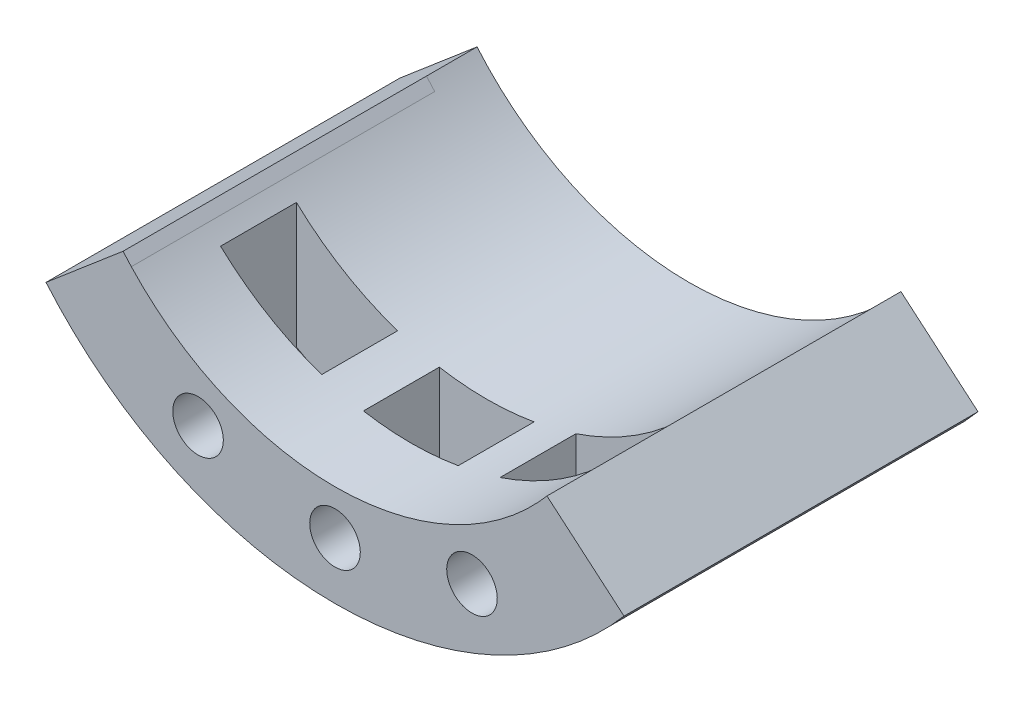
from build123d import *

# Parameters (mm, degrees)
SKETCH_1_R                = 20
SKETCH_1_R_2              = 2
EXTRUDE_1_DEPTH           = 4
EXTRUDE_START             = -4
EXTRUDE_2_DEPTH           = 4
FILLET_2_R                = 5
FILLET_3_R                = 5
SKETCH_3_R                = 58.160089131
SKETCH_3_R_2              = 39.60449563
CUT_EXTRUDE_1_DEPTH       = 4
FILLET_4_R                = 8
EXTRUDE_3_DEPTH           = 4
SKETCH_5_R                = 2
CUT_EXTRUDE_2_DEPTH       = 4
SKETCH_6_R                = 2
CUT_EXTRUDE_3_DEPTH       = 10
EXTRUDE_4_DEPTH           = 4
EXTRUDE_6_DEPTH           = 4
CUT_EXTRUDE_6_DEPTH       = 4
FILLET_6_R                = 10
FILLET_7_R                = 10
FILLET_8_R                = 10
SKETCH_11_R               = 2
EXTRUDE_7_DEPTH           = 4
SKETCH_12_R               = 54.16696545
SKETCH_12_R_2             = 30
CUT_EXTRUDE_7_DEPTH       = 4
FILLET_10_R               = 5
FILLET_11_R               = 5
SKETCH_13_R               = 2
CUT_EXTRUDE_8_DEPTH       = 4
EXTRUDE_START_2           = 28
EXTRUDE_8_DEPTH           = 28
EXTRUDE_START_3           = -28
EXTRUDE_9_DEPTH           = 28
EXTRUDE_10_DEPTH          = 4
CUT_EXTRUDE_START         = -10
SKETCH_17_R               = 2
CUT_EXTRUDE_9_DEPTH       = 10
CUT_EXTRUDE_11_DEPTH      = 35
CUT_EXTRUDE_12_DEPTH      = 36
CUT_EXTRUDE_12_DEPTH_BACK = 36
SKETCH_19_W               = 5.49642493
SKETCH_19_H               = 52.333928513
CUT_EXTRUDE_13_DEPTH      = 40


with BuildPart() as part:
    # 草图1 → 凸台-拉伸1 (new body)
    with BuildSketch(Plane.XY):
        Circle(SKETCH_1_R)
        with Locations((-15, 0)):
            Circle(SKETCH_1_R_2, mode=Mode.SUBTRACT)
        with Locations((15, 0)):
            Circle(SKETCH_1_R_2, mode=Mode.SUBTRACT)
        with Locations((-7.5, 12.990381057)):
            Circle(SKETCH_1_R_2, mode=Mode.SUBTRACT)
        with Locations((-7.5, -12.990381057)):
            Circle(SKETCH_1_R_2, mode=Mode.SUBTRACT)
        with Locations((7.5, -12.990381057)):
            Circle(SKETCH_1_R_2, mode=Mode.SUBTRACT)
        with Locations((7.5, 12.990381057)):
            Circle(SKETCH_1_R_2, mode=Mode.SUBTRACT)
    extrude(amount=EXTRUDE_1_DEPTH)

    # 草图2 → 凸台-拉伸2 (add)
    with BuildSketch(Plane.XY.offset(4).offset(EXTRUDE_START)):
        with BuildLine():
            add(Edge.make_bspline(
                [(-31.652235688, -31.652235688), (-33.388516019, -22.659494294), (-23.392443281, -20.962737075), (-16.1166561, -16.161254448), (-15.240575556, -12.950863166)],
                knots=[0, 0, 0, 0, 0.575012139, 0.86884139, 0.86884139, 0.86884139, 0.86884139], degree=3))
            ThreePointArc((-31.652235688, -31.652235688), (0, -44.76302099), (31.652235688, -31.652235688))
            add(Edge.make_bspline(
                [(31.652235688, -31.652235688), (33.388516019, -22.659494294), (23.392443281, -20.962737075), (16.1166561, -16.161254448), (15.240575556, -12.950863166)],
                knots=[0, 0, 0, 0, 0.575012139, 0.86884139, 0.86884139, 0.86884139, 0.86884139], degree=3))
            ThreePointArc((15.240575556, -12.950863166), (0, -20), (-15.240575556, -12.950863166))
        make_face()
    extrude(amount=EXTRUDE_2_DEPTH)

    # 圆角2
    fillet_2_edges = [part.edges().sort_by_distance(p)[0] for p in [
        (-31.652235688, -31.652235688, 2),
    ]]
    fillet(fillet_2_edges, radius=FILLET_2_R)

    # 圆角3
    fillet_3_edges = [part.edges().sort_by_distance(p)[0] for p in [
        (31.652235688, -31.652235688, 2),
    ]]
    fillet(fillet_3_edges, radius=FILLET_3_R)

    # 草图3 → 切除-拉伸1 (cut)
    with BuildSketch(Plane(origin=(0, 0, 0), x_dir=(-1, 0, 0), z_dir=(0, 0, -1))):
        Circle(SKETCH_3_R)
        Circle(SKETCH_3_R_2, mode=Mode.SUBTRACT)
    extrude(amount=-CUT_EXTRUDE_1_DEPTH, mode=Mode.SUBTRACT)

    # 圆角4
    fillet_4_edges = [part.edges().sort_by_distance(p)[0] for p in [
        (30.87581987, -24.803221997, 2),
        (-30.87581987, -24.803221997, 2),
    ]]
    fillet(fillet_4_edges, radius=FILLET_4_R)

    # 草图4 → 凸台-拉伸3 (add)
    with BuildSketch(Plane(origin=(0, 0, 0), x_dir=(-1, 0, 0), z_dir=(0, 0, -1))):
        with BuildLine():
            Line((-22.183787779, -32.808468935), (-22.405322857, -33.136105801))
            ThreePointArc((-22.405322857, -33.136105801), (0.038199329, -39.99998176), (22.468570811, -33.093251967))
            Line((22.468570811, -33.093251967), (22.183787779, -32.808468935))
            ThreePointArc((22.183787779, -32.808468935), (0, -39.60449563), (-22.183787779, -32.808468935))
        make_face()
    extrude(amount=-EXTRUDE_3_DEPTH)

    # 草图5 → 切除-拉伸2 (cut)
    with BuildSketch(Plane(origin=(0, 0, 0), x_dir=(-1, 0, 0), z_dir=(0, 0, -1))):
        with Locations((-15.848184815, -33.986542014)):
            Circle(SKETCH_5_R)
        with Locations((0, -37.5)):
            Circle(SKETCH_5_R)
        with Locations(Location((15.848184815, -33.986542014, 0), (0, 0, 180))):
            Circle(SKETCH_5_R)
    extrude(amount=-CUT_EXTRUDE_2_DEPTH, mode=Mode.SUBTRACT)

    # 草图6 → 切除-拉伸3 (cut)
    with BuildSketch(Plane(origin=(0, 0, 0), x_dir=(-1, 0, 0), z_dir=(0, 0, -1))):
        with Locations((0.038199329, -29.99998176)):
            Circle(SKETCH_6_R)
    extrude(amount=-CUT_EXTRUDE_3_DEPTH, mode=Mode.SUBTRACT)

    # 草图7 → 凸台-拉伸4 (add)
    with BuildSketch(Plane.XY.offset(4)):
        with BuildLine():
            Line((-22.468570811, -33.093251967), (-23.907156981, -34.531838137))
            ThreePointArc((-23.907156981, -34.531838137), (-0.231167262, -41.999363825), (23.525589, -34.792911091))
            Line((23.525589, -34.792911091), (22.405322857, -33.136105801))
            Line((22.405322857, -33.136105801), (22.183787779, -32.808468935))
            ThreePointArc((22.183787779, -32.808468935), (0, -39.60449563), (-22.183787779, -32.808468935))
            Line((-22.183787779, -32.808468935), (-22.468570811, -33.093251967))
        make_face()
    extrude(amount=-EXTRUDE_4_DEPTH)

    # 草图8 → 凸台-拉伸6 (add)
    with BuildSketch(Plane(origin=(0, 0, 0), x_dir=(-1, 0, 0), z_dir=(0, 0, -1))):
        with BuildLine():
            Line((-25.678439695, -25.558394246), (-20.516854663, -32.863070329))
            Line((-20.516854663, -32.863070329), (-23.525589, -34.792911091))
            add(Edge.make_bspline(
                [(-23.525589, -34.792911091), (-26.001835591, -30.056258517), (-25.678439695, -25.558394246)],
                knots=[0, 0, 0, 0.47951431, 0.47951431, 0.47951431], degree=2))
        make_face()
        with BuildLine():
            Line((20.516854663, -32.863070329), (23.525589, -34.792911091))
            add(Edge.make_bspline(
                [(23.525589, -34.792911091), (26.001835591, -30.056258517), (25.678439695, -25.558394246)],
                knots=[0, 0, 0, 0.47951431, 0.47951431, 0.47951431], degree=2))
            Line((25.678439695, -25.558394246), (20.516854663, -32.863070329))
        make_face()
    extrude(amount=-EXTRUDE_6_DEPTH)

    # 草图9 → 切除-拉伸6 (cut)
    with BuildSketch(Plane(origin=(0, 0, 0), x_dir=(-1, 0, 0), z_dir=(0, 0, -1))):
        Polygon((23.742659966, -34.367341122), (22.906265437, -35.20373565), (24.433492861, -34.374984505), align=None)
    extrude(amount=-CUT_EXTRUDE_6_DEPTH, mode=Mode.SUBTRACT)

    # 圆角6
    fillet_6_edges = [part.edges().sort_by_distance(p)[0] for p in [
        (23.525589, -34.792911091, 2),
    ]]
    fillet(fillet_6_edges, radius=FILLET_6_R)

    # 圆角7
    # the kernel refuses this fillet: 10 mm, written as the material it takes off along each edge
    with BuildSketch(Plane(origin=(-23.742659966, -34.367341122, 10.292446297), x_dir=(0.7071067812003878, -0.7071067811727072, 0), z_dir=(0, 0, -1))) as fillet_7_piece_1:
        with BuildLine():
            CenterArc((1.956172782, -9.970053017), FILLET_7_R, 94.435296014, 20.980736708)
            Line((-2.335706132, -0.937900705), (-2.42154371, -0.757257658))
            ThreePointArc((-2.42154371, -0.757257658), (-1.256201499, -0.248323162), (-0.06365122, 0.189600955))
            Line((-0.06365122, 0.189600955), (0, 0.2))
            ThreePointArc((0, 0.2), (0.591420243, 0.2), (1.16737384, 0.19940106))
            Line((1.16737384, 0.19940106), (1.182840486, 0))
        make_face()
    extrude(amount=16.584892581, mode=Mode.SUBTRACT)

    # 圆角8
    fillet_8_edges = [part.edges().sort_by_distance(p)[0] for p in [
        (-22.906265437, -35.20373565, 2),
    ]]
    fillet(fillet_8_edges, radius=FILLET_8_R)

    # 草图11 → 凸台-拉伸7 (add)
    with BuildSketch(Plane(origin=(0, 0, 0), x_dir=(-1, 0, 0), z_dir=(0, 0, -1))):
        with Locations((0.038199329, -29.99998176)):
            Circle(SKETCH_11_R)
        with Locations((0, -37.5)):
            Circle(SKETCH_11_R)
        with Locations((15.848184815, -33.986542014)):
            Circle(SKETCH_11_R)
        with Locations((-15.848184815, -33.986542014)):
            Circle(SKETCH_11_R)
    extrude(amount=-EXTRUDE_7_DEPTH)

    # 草图12 → 切除-拉伸7 (cut)
    with BuildSketch(Plane(origin=(0, 0, 0), x_dir=(-1, 0, 0), z_dir=(0, 0, -1))):
        Circle(SKETCH_12_R)
        Circle(SKETCH_12_R_2, mode=Mode.SUBTRACT)
    extrude(amount=-CUT_EXTRUDE_7_DEPTH, mode=Mode.SUBTRACT)

    # 圆角10
    fillet_10_edges = [part.edges().sort_by_distance(p)[0] for p in [
        (-22.533836729, -19.804701519, 2),
    ]]
    fillet(fillet_10_edges, radius=FILLET_10_R)

    # 圆角11
    fillet_11_edges = [part.edges().sort_by_distance(p)[0] for p in [
        (22.533836729, -19.804701519, 2),
    ]]
    fillet(fillet_11_edges, radius=FILLET_11_R)

    # 草图13 → 切除-拉伸8 (cut)
    with BuildSketch(Plane(origin=(0, 0, 0), x_dir=(-1, 0, 0), z_dir=(0, 0, -1))):
        with Locations((0, -25.5)):
            Circle(SKETCH_13_R)
        with Locations((-10.834875534, -23.235465565)):
            Circle(SKETCH_13_R)
        with Locations(Location((10.834875534, -23.235465565, 0), (0, 0, 180))):
            Circle(SKETCH_13_R)
    extrude(amount=-CUT_EXTRUDE_8_DEPTH, mode=Mode.SUBTRACT)

    # 草图14 → 凸台-拉伸8 (add)
    with BuildSketch(Plane(origin=(0, 0, 0), x_dir=(-1, 0, 0), z_dir=(0, 0, -1)).offset(EXTRUDE_START_2)):
        with BuildLine():
            Line((-16.764633111, -14.245949482), (-22.860863333, -19.426294749))
            ThreePointArc((-22.860863333, -19.426294749), (0, -30), (22.860863333, -19.426294749))
            Line((22.860863333, -19.426294749), (16.764633111, -14.245949482))
            ThreePointArc((16.764633111, -14.245949482), (0, -22), (-16.764633111, -14.245949482))
        make_face()
    extrude(amount=-EXTRUDE_8_DEPTH)

    # 草图15 → 凸台-拉伸9 (add)
    with BuildSketch(Plane.XY.offset(4).offset(EXTRUDE_START_3)):
        with BuildLine():
            Line((-22.860863333, -19.426294749), (-16.764633111, -14.245949482))
            Line((-16.764633111, -14.245949482), (-16.112026358, -14.980073652))
            Line((-16.112026358, -14.980073652), (-17.163654071, -24.605060027))
            ThreePointArc((-17.163654071, -24.605060027), (-20.17908325, -22.19920267), (-22.860863333, -19.426294749))
        make_face()
        with BuildLine():
            Line((16.112026358, -14.980073652), (17.163654071, -24.605060027))
            ThreePointArc((17.163654071, -24.605060027), (20.17908325, -22.19920267), (22.860863333, -19.426294749))
            Line((22.860863333, -19.426294749), (16.764633111, -14.245949482))
            Line((16.764633111, -14.245949482), (16.112026358, -14.980073652))
        make_face()
    extrude(amount=EXTRUDE_9_DEPTH)

    # 草图16 → 凸台-拉伸10 (add)
    with BuildSketch(Plane.XY.offset(4)):
        Polygon((22.860863333, -19.426294749), (12.832928653, -10.904936129), (17.846895993, -20.488091499), align=None)
        Polygon((-17.846895993, -20.488091499), (-22.860863333, -19.426294749), (-12.832928653, -10.904936129), align=None)
    extrude(amount=-EXTRUDE_10_DEPTH)

    # 草图17 → 切除-拉伸9 (cut)
    with BuildSketch(Plane.XY.offset(4).offset(CUT_EXTRUDE_START)):
        with Locations((-10.834875534, -23.235465565)):
            Circle(SKETCH_17_R)
        with Locations(Location((0, -25.5, 0), (0, 0, 180))):
            Circle(SKETCH_17_R)
        with Locations(Location((10.834875534, -23.235465565, 0), (0, 0, 180))):
            Circle(SKETCH_17_R)
    extrude(amount=CUT_EXTRUDE_9_DEPTH, mode=Mode.SUBTRACT)

    # 草图18 → 切除-拉伸11 (cut)
    with BuildSketch(Plane(origin=(0, 0, 0), x_dir=(1, 0, 0), z_dir=(0, 1, 0))):
        Polygon((13.552574472, 6), (11.552574472, 6), (8.552574472, 6), (8.552574472, 9), (11.552574472, 9), (13.552574472, 9), align=None)
        Polygon((-2, 9), (-2.5, 9), (-2.5, 6), (-2, 6), (0, 6), (2, 6), (2.5, 6), (2.5, 9), (2, 9), align=None)
        Polygon((-13.552574472, 9), (-13.552574472, 6), (-11.552574472, 6), (-8.552574472, 6), (-8.552574472, 9), (-11.552574472, 9), align=None)
    extrude(amount=-CUT_EXTRUDE_11_DEPTH, mode=Mode.SUBTRACT)

    # 草图19 → 切除-拉伸12 (cut, two sides: drawn at the far end of the back side and taken through both)
    with BuildSketch(Plane(origin=(0, 0, 0), x_dir=(0, 0, -1), z_dir=(1, 0, 0)).offset(-CUT_EXTRUDE_12_DEPTH_BACK)):
        with Locations((-2.748212465, -6.166964257)):
            Rectangle(SKETCH_19_W, SKETCH_19_H)
    extrude(amount=CUT_EXTRUDE_12_DEPTH + CUT_EXTRUDE_12_DEPTH_BACK, mode=Mode.SUBTRACT)

    # 草图20 → 切除-拉伸13 (cut)
    with BuildSketch(Plane(origin=(0, 0, 0), x_dir=(1, 0, 0), z_dir=(0, 1, 0))):
        Polygon((-7.552574472, 12), (-7.052574472, 12), (-7.052574472, 6), (-7.552574472, 6), (-14.552574472, 6), (-15.052574472, 6), (-15.052574472, 12), (-14.552574472, 12), (-13.552574472, 12), (-8.552574472, 12), align=None)
        Polygon((2.5, 6), (3.75, 6), (3.75, 12), (-3.75, 12), (-3.75, 6), align=None)
        Polygon((15.052574472, 6), (14.552574472, 6), (7.552574472, 6), (7.052574472, 6), (7.052574472, 12), (7.552574472, 12), (8.552574472, 12), (13.552574472, 12), (14.552574472, 12), (15.052574472, 12), align=None)
    extrude(amount=-CUT_EXTRUDE_13_DEPTH, mode=Mode.SUBTRACT)


solid = part.part
